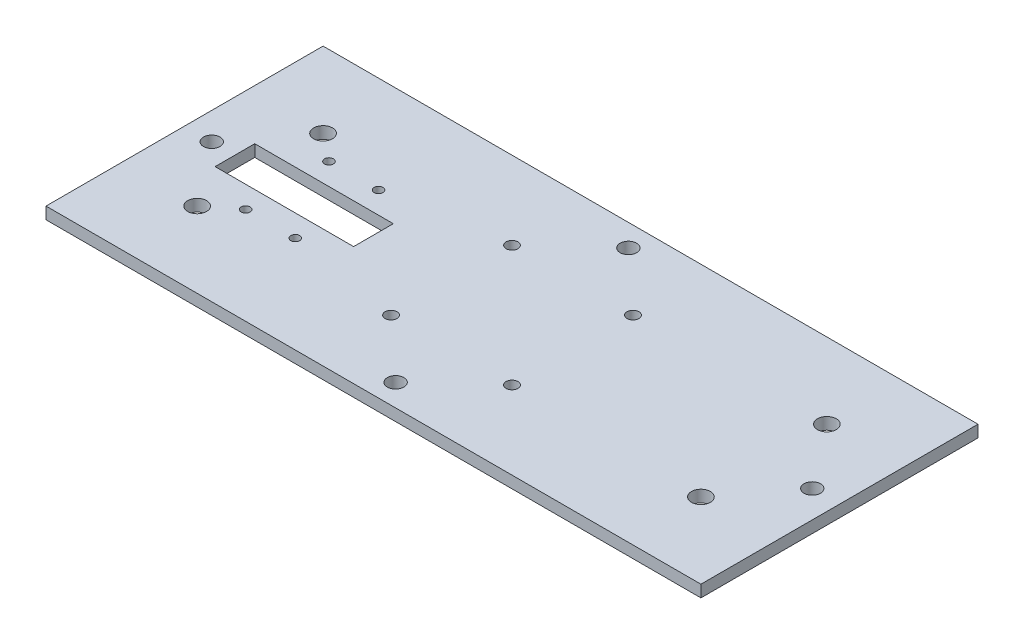
from build123d import *

# Parameters (mm, degrees)
SKETCH1_W           = 165.1
SKETCH1_H           = 69.85
BOSS_EXTRUDE1_DEPTH = 3
CUT_EXTRUDE1_REACH  = 91.684
SKETCH6_R           = 1.5
SKETCH6_W           = 34.925
SKETCH6_H           = 10
CUT_EXTRUDE3_REACH  = 91.684
SKETCH8_R           = 2.38125
SKETCH9_R           = 2.0828
CUT_EXTRUDE5_DEPTH  = 5.08
SKETCH10_R          = 2.0828
CUT_EXTRUDE6_DEPTH  = 5.08
SKETCH11_R          = 1.125
SKETCH11_R_2        = 1.125000036
CUT_EXTRUDE7_DEPTH  = 41.91


with BuildPart() as part:
    # Sketch1 → Boss-Extrude1 (new body)
    with BuildSketch(Plane(origin=(0, 0, 0), x_dir=(1, 0, 0), z_dir=(0, 1, 0))):
        Rectangle(SKETCH1_W, SKETCH1_H)
    extrude(amount=BOSS_EXTRUDE1_DEPTH)

    # Sketch6 → Cut-Extrude1 (cut, up to next)
    with BuildSketch(Plane.XZ, mode=Mode.PRIVATE) as cut_extrude1_sk1:
        with Locations((-15.25, 15.25)):
            Circle(SKETCH6_R)
    cut_extrude1_tool1 = extrude(cut_extrude1_sk1.sketch, amount=-CUT_EXTRUDE1_REACH, mode=Mode.PRIVATE) & part.part
    # Sketch6 → Cut-Extrude1 (cut, up to next)
    with BuildSketch(Plane.XZ, mode=Mode.PRIVATE) as cut_extrude1_sk2:
        with Locations((15.25, 15.25)):
            Circle(SKETCH6_R)
    cut_extrude1_tool2 = extrude(cut_extrude1_sk2.sketch, amount=-CUT_EXTRUDE1_REACH, mode=Mode.PRIVATE) & part.part
    # Sketch6 → Cut-Extrude1 (cut, up to next)
    with BuildSketch(Plane.XZ, mode=Mode.PRIVATE) as cut_extrude1_sk3:
        with Locations((-15.25, -15.25)):
            Circle(SKETCH6_R)
    cut_extrude1_tool3 = extrude(cut_extrude1_sk3.sketch, amount=-CUT_EXTRUDE1_REACH, mode=Mode.PRIVATE) & part.part
    # Sketch6 → Cut-Extrude1 (cut, up to next)
    with BuildSketch(Plane.XZ, mode=Mode.PRIVATE) as cut_extrude1_sk4:
        with Locations((15.25, -15.25)):
            Circle(SKETCH6_R)
    cut_extrude1_tool4 = extrude(cut_extrude1_sk4.sketch, amount=-CUT_EXTRUDE1_REACH, mode=Mode.PRIVATE) & part.part
    # Sketch6 → Cut-Extrude1 (cut, up to next)
    with BuildSketch(Plane.XZ, mode=Mode.PRIVATE) as cut_extrude1_sk5:
        with Locations((-52.3875, 0)):
            Rectangle(SKETCH6_W, SKETCH6_H)
    cut_extrude1_tool5 = extrude(cut_extrude1_sk5.sketch, amount=-CUT_EXTRUDE1_REACH, mode=Mode.PRIVATE) & part.part
    add(cut_extrude1_tool1.solids().sort_by_distance((-15.25, 0, 15.25))[0], mode=Mode.SUBTRACT)
    add(cut_extrude1_tool2.solids().sort_by_distance((15.25, 0, 15.25))[0], mode=Mode.SUBTRACT)
    add(cut_extrude1_tool3.solids().sort_by_distance((-15.25, 0, -15.25))[0], mode=Mode.SUBTRACT)
    add(cut_extrude1_tool4.solids().sort_by_distance((15.25, 0, -15.25))[0], mode=Mode.SUBTRACT)
    add(cut_extrude1_tool5.solids().sort_by_distance((-52.3875, 0, 0))[0], mode=Mode.SUBTRACT)

    # Sketch8 → Cut-Extrude3 (cut, up to next)
    with BuildSketch(Plane(origin=(0, 3, 0), x_dir=(1, 0, 0), z_dir=(0, 1, 0)), mode=Mode.PRIVATE) as cut_extrude3_sk1:
        with Locations((-63.5, -15.875)):
            Circle(SKETCH8_R)
    cut_extrude3_tool1 = extrude(cut_extrude3_sk1.sketch, amount=-CUT_EXTRUDE3_REACH, mode=Mode.PRIVATE) & part.part
    # Sketch8 → Cut-Extrude3 (cut, up to next)
    with BuildSketch(Plane(origin=(0, 3, 0), x_dir=(1, 0, 0), z_dir=(0, 1, 0)), mode=Mode.PRIVATE) as cut_extrude3_sk2:
        with Locations((-63.5, 15.875)):
            Circle(SKETCH8_R)
    cut_extrude3_tool2 = extrude(cut_extrude3_sk2.sketch, amount=-CUT_EXTRUDE3_REACH, mode=Mode.PRIVATE) & part.part
    # Sketch8 → Cut-Extrude3 (cut, up to next)
    with BuildSketch(Plane(origin=(0, 3, 0), x_dir=(1, 0, 0), z_dir=(0, 1, 0)), mode=Mode.PRIVATE) as cut_extrude3_sk3:
        with Locations((63.5, 15.875)):
            Circle(SKETCH8_R)
    cut_extrude3_tool3 = extrude(cut_extrude3_sk3.sketch, amount=-CUT_EXTRUDE3_REACH, mode=Mode.PRIVATE) & part.part
    # Sketch8 → Cut-Extrude3 (cut, up to next)
    with BuildSketch(Plane(origin=(0, 3, 0), x_dir=(1, 0, 0), z_dir=(0, 1, 0)), mode=Mode.PRIVATE) as cut_extrude3_sk4:
        with Locations((63.5, -15.875)):
            Circle(SKETCH8_R)
    cut_extrude3_tool4 = extrude(cut_extrude3_sk4.sketch, amount=-CUT_EXTRUDE3_REACH, mode=Mode.PRIVATE) & part.part
    add(cut_extrude3_tool1.solids().sort_by_distance((-63.5, 3, 15.875))[0], mode=Mode.SUBTRACT)
    add(cut_extrude3_tool2.solids().sort_by_distance((-63.5, 3, -15.875))[0], mode=Mode.SUBTRACT)
    add(cut_extrude3_tool3.solids().sort_by_distance((63.5, 3, -15.875))[0], mode=Mode.SUBTRACT)
    add(cut_extrude3_tool4.solids().sort_by_distance((63.5, 3, 15.875))[0], mode=Mode.SUBTRACT)

    # Sketch9 → Cut-Extrude5 (cut)
    with BuildSketch(Plane(origin=(0, 3, 0), x_dir=(1, 0, 0), z_dir=(0, 1, 0))):
        with Locations((-75.692, 0)):
            Circle(SKETCH9_R)
        with Locations((75.692, 0)):
            Circle(SKETCH9_R)
    extrude(amount=-CUT_EXTRUDE5_DEPTH, mode=Mode.SUBTRACT)

    # Sketch10 → Cut-Extrude6 (cut)
    with BuildSketch(Plane(origin=(0, 3, 0), x_dir=(1, 0, 0), z_dir=(0, 1, 0))):
        with Locations((0, -29.337)):
            Circle(SKETCH10_R)
        with Locations((0, 29.337)):
            Circle(SKETCH10_R)
    extrude(amount=-CUT_EXTRUDE6_DEPTH, mode=Mode.SUBTRACT)

    # Sketch11 → Cut-Extrude7 (cut)
    with BuildSketch(Plane(origin=(0, 3, 0), x_dir=(1, 0, 0), z_dir=(0, 1, 0))):
        with Locations((-56.6375, 10.5)):
            Circle(SKETCH11_R)
        with Locations((-44.1375, 10.5)):
            Circle(SKETCH11_R_2)
        with Locations((-44.1375, -10.5)):
            Circle(SKETCH11_R_2)
        with Locations((-56.6375, -10.5)):
            Circle(SKETCH11_R_2)
    extrude(amount=-CUT_EXTRUDE7_DEPTH, mode=Mode.SUBTRACT)


solid = part.part
